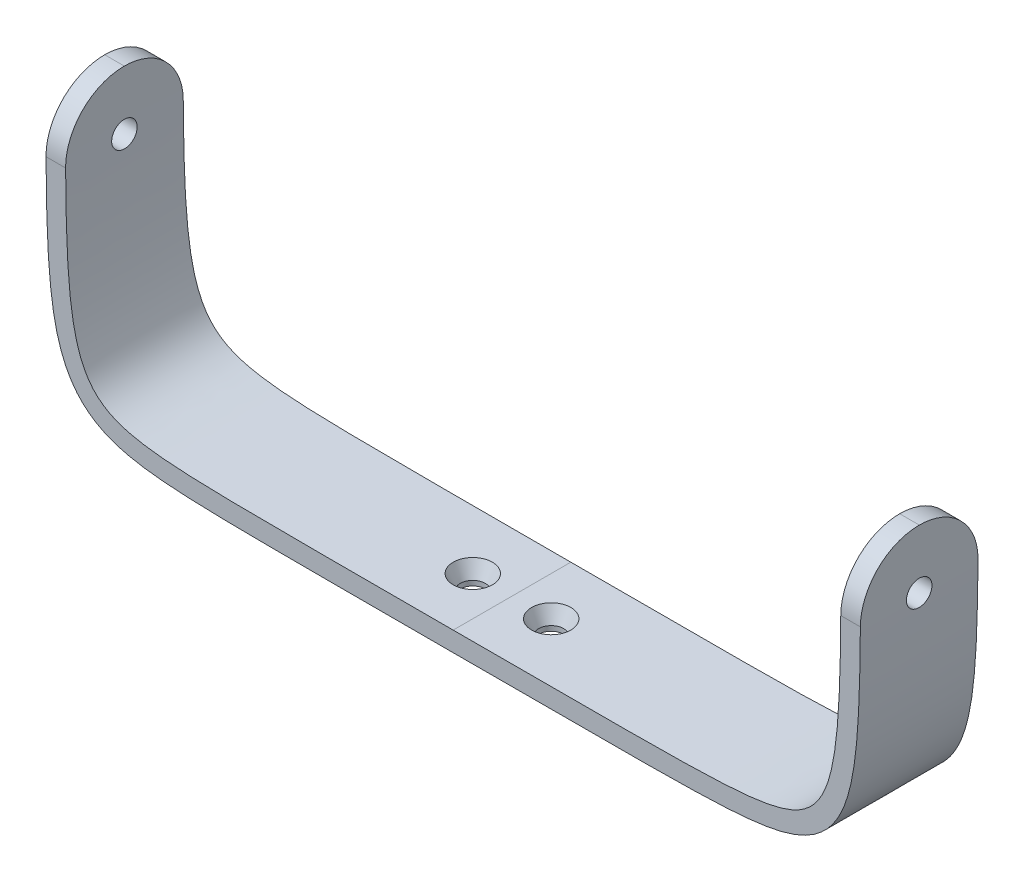
from build123d import *

# Parameters (mm, degrees)
THICKEN_START                 = 4.213749482
THICKEN_1_DEPTH               = 12
FILLET_1_R                    = 6
CUT_EXTRUDE_1_DEPTH           = 69.240442134
CUT_EXTRUDE_1_DEPTH_BACK      = 69.240442134
SKETCH_2_R                    = 1.3
SKETCH_5_R                    = 2
CUT_EXTRUDE_2_DEPTH           = 1.5
CUT_EXTRUDE_2_TAPER           = 26
CUT_EXTRUDE_2_OTHER_WAY_DEPTH = 58.450141944
CUT_EXTRUDE_START             = -0.499996037
CUT_EXTRUDE_3_OUTLINE_R       = 1.268401117
CUT_EXTRUDE_3_DEPTH           = 0.499996037


# Read off the part's stored shape, not the designer's step: 加厚1, 切除-拉伸3
with BuildPart() as part:
    # 加厚1 outline → 加厚1 (new body)
    with BuildSketch(Plane.XY.offset(THICKEN_START)):
        with BuildLine():
            Line((-33.078945041, -16.642686601), (-35.078945041, -16.642686601))
            add(Edge.make_bspline(
                [(-35.078945041, -16.642686601), (-35.078945041, -18.555150468), (-35.078947674, -20.378489235), (-35.076181618, -22.113510267), (-35.068204735, -23.761403592), (-35.052824506, -25.323711639), (-35.028039406, -26.802322712), (-34.991986534, -28.199482062), (-34.942880793, -29.51781444), (-34.878930925, -30.760352018), (-34.798217704, -31.930561525), (-34.698519585, -33.032364508), (-34.45562265, -35.10792463), (-34.312418694, -36.081685521), (-34.144699794, -36.995695908), (-33.949059111, -37.85517839), (-33.721416726, -38.663773156), (-33.456476064, -39.429945805), (-33.146234088, -40.152621069), (-32.784913581, -40.841912593), (-32.354930378, -41.489651005), (-31.858775876, -42.082641367), (-31.302194988, -42.613551199), (-30.082246414, -43.547194233), (-29.418875386, -43.949922646), (-28.708978821, -44.286761038), (-27.960196149, -44.56101886), (-27.174899929, -44.785221349), (-26.344011356, -44.969619179), (-25.458001417, -45.120756593), (-24.507751798, -45.244125327), (-23.481156155, -45.344523405), (-22.367683157, -45.425311322), (-21.155236487, -45.489794592), (-18.507853484, -45.591533391), (-17.072909822, -45.628797221), (-15.514358552, -45.655178525), (-13.819297846, -45.673010942), (-11.974162133, -45.684323609), (-9.964612603, -45.690884326), (-7.775435664, -45.694210811), (-5.390449409, -45.695559875), (-2.792418172, -45.695904356), (0.037024765, -45.69590763), (3.117446241, -45.695905533), (6.469673988, -45.695905533)],
                knots=[0, 0, 0, 0, 0, 0, 0, 0, 0, 0, 0, 0, 0, 0.25, 0.25, 0.25, 0.25, 0.25, 0.25, 0.25, 0.25, 0.25, 0.25, 0.25, 0.5, 0.5, 0.5, 0.5, 0.5, 0.5, 0.5, 0.5, 0.5, 0.5, 0.5, 0.75, 0.75, 0.75, 0.75, 0.75, 0.75, 0.75, 0.75, 0.75, 0.75, 0.75, 1, 1, 1, 1, 1, 1, 1, 1, 1, 1, 1, 1, 1], degree=12))
            add(Edge.make_bspline(
                [(6.469673988, -45.695905533), (9.821901735, -45.695905533), (12.902323211, -45.69590763), (15.731766148, -45.695904356), (18.329797385, -45.695559875), (20.71478364, -45.694210811), (22.903960579, -45.690884326), (24.913510109, -45.684323609), (26.758645822, -45.673010942), (28.453706528, -45.655178525), (30.012257798, -45.628797221), (31.44720146, -45.591533391), (34.094584463, -45.489794592), (35.307031134, -45.425311322), (36.420504131, -45.344523405), (37.447099774, -45.244125327), (38.397349393, -45.120756593), (39.283359332, -44.969619179), (40.114247905, -44.785221349), (40.899544125, -44.56101886), (41.648326797, -44.286761038), (42.358223362, -43.949922646), (43.02159439, -43.547194233), (44.241542964, -42.613551199), (44.798123852, -42.082641367), (45.294278354, -41.489651005), (45.724261557, -40.841912593), (46.085582064, -40.152621069), (46.39582404, -39.429945805), (46.660764702, -38.663773156), (46.888407087, -37.85517839), (47.08404777, -36.995695908), (47.25176667, -36.081685521), (47.394970626, -35.10792463), (47.637867561, -33.032364508), (47.73756568, -31.930561525), (47.818278901, -30.760352018), (47.882228769, -29.51781444), (47.93133451, -28.199482062), (47.967387382, -26.802322712), (47.992172482, -25.323711639), (48.007552711, -23.761403592), (48.015529594, -22.113510267), (48.01829565, -20.378489235), (48.018293017, -18.555150468), (48.018293017, -16.642686601)],
                knots=[0, 0, 0, 0, 0, 0, 0, 0, 0, 0, 0, 0, 0, 0.25, 0.25, 0.25, 0.25, 0.25, 0.25, 0.25, 0.25, 0.25, 0.25, 0.25, 0.5, 0.5, 0.5, 0.5, 0.5, 0.5, 0.5, 0.5, 0.5, 0.5, 0.5, 0.75, 0.75, 0.75, 0.75, 0.75, 0.75, 0.75, 0.75, 0.75, 0.75, 0.75, 1, 1, 1, 1, 1, 1, 1, 1, 1, 1, 1, 1, 1], degree=12))
            Line((48.018293017, -16.642686601), (46.018293017, -16.642686601))
            add(Edge.make_bspline(
                [(46.018293017, -16.642686601), (46.018293017, -35.002339727), (46.018293017, -43.695905533), (42.129624527, -43.695905533), (38.651060359, -43.695905533), (-25.711712383, -43.695905533), (-29.190276551, -43.695905533), (-33.078945041, -43.695905533), (-33.078945041, -35.002339727), (-33.078945041, -16.642686601)],
                knots=[0, 0, 0, 0, 0, 0, 1, 1, 1, 1, 2, 2, 2, 2, 2, 2], degree=5))
        make_face()
    extrude(amount=THICKEN_1_DEPTH)

    # 圆角1
    fillet_1_edges = [part.edges().sort_by_distance(p)[0] for p in [
        (47.018293017, -16.642686601, 4.213749482),
        (47.018293017, -16.642686601, 16.213749482),
        (-34.078945041, -16.642686601, 16.213749482),
        (-34.078945041, -16.642686601, 4.213749482),
    ]]
    fillet(fillet_1_edges, radius=FILLET_1_R - 0.0001)  # a hair under: the kernel refuses the full size

    # 草图2 → 切除-拉伸1 (cut, two sides: drawn at the far end of the back side and taken through both)
    with BuildSketch(Plane(origin=(0, 0, 0), x_dir=(0, 0, -1), z_dir=(1, 0, 0)).offset(-CUT_EXTRUDE_1_DEPTH_BACK)):
        with Locations((-10.213749482, -22.642686601)):
            Circle(SKETCH_2_R)
    extrude(amount=CUT_EXTRUDE_1_DEPTH + CUT_EXTRUDE_1_DEPTH_BACK, mode=Mode.SUBTRACT)

    # 草图5 → 切除-拉伸2 (cut)
    with BuildSketch(Plane(origin=(0, -43.695905533, 0), x_dir=(1, 0, 0), z_dir=(0, 1, 0))):
        with Locations((10.469673988, -10.213749482)):
            Circle(SKETCH_5_R)
        with Locations((2.469673988, -10.213749482)):
            Circle(SKETCH_5_R)
    extrude(amount=-CUT_EXTRUDE_2_DEPTH, taper=CUT_EXTRUDE_2_TAPER, mode=Mode.SUBTRACT)

    # 草图5 → 切除-拉伸2 other way (cut)
    with BuildSketch(Plane(origin=(0, -43.695905533, 0), x_dir=(1, 0, 0), z_dir=(0, 1, 0))):
        with Locations((10.469673988, -10.213749482)):
            Circle(SKETCH_5_R)
        with Locations((2.469673988, -10.213749482)):
            Circle(SKETCH_5_R)
    extrude(amount=CUT_EXTRUDE_2_OTHER_WAY_DEPTH, mode=Mode.SUBTRACT)

    # 切除-拉伸3 outline → 切除-拉伸3 (cut)
    with BuildSketch(Plane(origin=(0, -45.195905533, 0), x_dir=(1, 0, 0), z_dir=(0, 1, 0)).offset(CUT_EXTRUDE_START)):
        with Locations((2.469673988, -10.213749482)):
            Circle(CUT_EXTRUDE_3_OUTLINE_R)
        with Locations((10.469673988, -10.213749482)):
            Circle(CUT_EXTRUDE_3_OUTLINE_R)
    extrude(amount=CUT_EXTRUDE_3_DEPTH, mode=Mode.SUBTRACT)


solid = part.part
